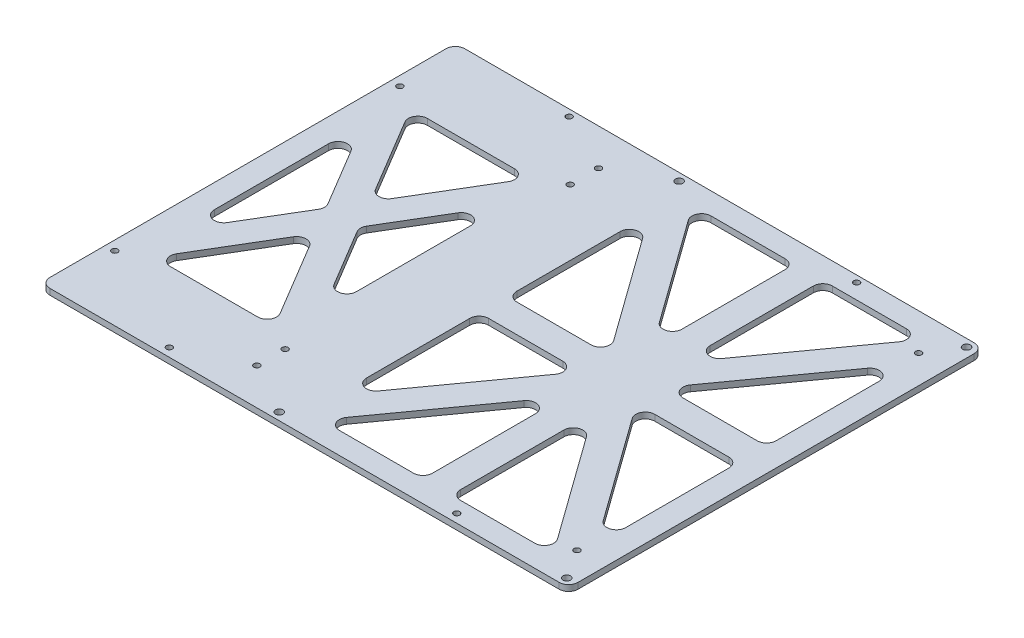
from build123d import *

# Parameters (mm, degrees)
SKETCH1_R                  = 3.175
BODY_DEPTH                 = 6.35
ELECTRONICS_BOX_REACH      = 358.146
SKETCH3_R                  = 4
BATTERY_CHARGER_REACH      = 358.146
SKETCH5_R                  = 3.175
FILLETS_REACH              = 358.146
PLANT_MOUNTING_HOLES_REACH = 358.146
SKETCH7_R                  = 3.175


with BuildPart() as part:
    # Sketch1 → Body (new body)
    with BuildSketch(Plane(origin=(0, 0, 0), x_dir=(1, 0, 0), z_dir=(0, 1, 0))):
        with BuildLine():
            Line((-280, -210), (-280, 210))
            ThreePointArc((-280, 210), (-277.071067812, 217.071067812), (-270, 220))
            Line((-270, 220), (270, 220))
            ThreePointArc((270, 220), (277.071067812, 217.071067812), (280, 210))
            Line((280, 210), (280, -210))
            ThreePointArc((280, -210), (277.071067812, -217.071067812), (270, -220))
            Line((270, -220), (-270, -220))
            ThreePointArc((-270, -220), (-277.071067812, -217.071067812), (-280, -210))
        make_face()
        with Locations((-152.4, -210.96)):
            Circle(SKETCH1_R, mode=Mode.SUBTRACT)
        with Locations((152.4, -210.96)):
            Circle(SKETCH1_R, mode=Mode.SUBTRACT)
        with Locations((152.4, 213)):
            Circle(SKETCH1_R, mode=Mode.SUBTRACT)
        with Locations((-152.4, 213)):
            Circle(SKETCH1_R, mode=Mode.SUBTRACT)
    extrude(amount=BODY_DEPTH)

    # Sketch3 → Electronics Box (cut, up to next)
    with BuildSketch(Plane(origin=(0, 6.35, 0), x_dir=(1, 0, 0), z_dir=(0, 1, 0)), mode=Mode.PRIVATE) as electronics_box_sk1:
        with Locations((-34.8, -211.98)):
            Circle(SKETCH3_R)
    electronics_box_tool1 = extrude(electronics_box_sk1.sketch, amount=-ELECTRONICS_BOX_REACH, mode=Mode.PRIVATE) & part.part
    # Sketch3 → Electronics Box (cut, up to next)
    with BuildSketch(Plane(origin=(0, 6.35, 0), x_dir=(1, 0, 0), z_dir=(0, 1, 0)), mode=Mode.PRIVATE) as electronics_box_sk2:
        with Locations((270, -211.98)):
            Circle(SKETCH3_R)
    electronics_box_tool2 = extrude(electronics_box_sk2.sketch, amount=-ELECTRONICS_BOX_REACH, mode=Mode.PRIVATE) & part.part
    # Sketch3 → Electronics Box (cut, up to next)
    with BuildSketch(Plane(origin=(0, 6.35, 0), x_dir=(1, 0, 0), z_dir=(0, 1, 0)), mode=Mode.PRIVATE) as electronics_box_sk3:
        with Locations((270, 211.98)):
            Circle(SKETCH3_R)
    electronics_box_tool3 = extrude(electronics_box_sk3.sketch, amount=-ELECTRONICS_BOX_REACH, mode=Mode.PRIVATE) & part.part
    # Sketch3 → Electronics Box (cut, up to next)
    with BuildSketch(Plane(origin=(0, 6.35, 0), x_dir=(1, 0, 0), z_dir=(0, 1, 0)), mode=Mode.PRIVATE) as electronics_box_sk4:
        with Locations((-34.8, 211.98)):
            Circle(SKETCH3_R)
    electronics_box_tool4 = extrude(electronics_box_sk4.sketch, amount=-ELECTRONICS_BOX_REACH, mode=Mode.PRIVATE) & part.part
    add(electronics_box_tool1.solids().sort_by_distance((-34.8, 6.35, 211.98))[0], mode=Mode.SUBTRACT)
    add(electronics_box_tool2.solids().sort_by_distance((270, 6.35, 211.98))[0], mode=Mode.SUBTRACT)
    add(electronics_box_tool3.solids().sort_by_distance((270, 6.35, -211.98))[0], mode=Mode.SUBTRACT)
    add(electronics_box_tool4.solids().sort_by_distance((-34.8, 6.35, -211.98))[0], mode=Mode.SUBTRACT)

    # Sketch5 → Battery Charger (cut, up to next)
    with BuildSketch(Plane(origin=(0, 6.35, 0), x_dir=(1, 0, 0), z_dir=(0, 1, 0)), mode=Mode.PRIVATE) as battery_charger_sk1:
        with Locations((-270, -151.13)):
            Circle(SKETCH5_R)
    battery_charger_tool1 = extrude(battery_charger_sk1.sketch, amount=-BATTERY_CHARGER_REACH, mode=Mode.PRIVATE) & part.part
    # Sketch5 → Battery Charger (cut, up to next)
    with BuildSketch(Plane(origin=(0, 6.35, 0), x_dir=(1, 0, 0), z_dir=(0, 1, 0)), mode=Mode.PRIVATE) as battery_charger_sk2:
        with Locations((-270, 151.13)):
            Circle(SKETCH5_R)
    battery_charger_tool2 = extrude(battery_charger_sk2.sketch, amount=-BATTERY_CHARGER_REACH, mode=Mode.PRIVATE) & part.part
    # Sketch5 → Battery Charger (cut, up to next)
    with BuildSketch(Plane(origin=(0, 6.35, 0), x_dir=(1, 0, 0), z_dir=(0, 1, 0)), mode=Mode.PRIVATE) as battery_charger_sk3:
        with Locations((-89.43, -151.13)):
            Circle(SKETCH5_R)
    battery_charger_tool3 = extrude(battery_charger_sk3.sketch, amount=-BATTERY_CHARGER_REACH, mode=Mode.PRIVATE) & part.part
    # Sketch5 → Battery Charger (cut, up to next)
    with BuildSketch(Plane(origin=(0, 6.35, 0), x_dir=(1, 0, 0), z_dir=(0, 1, 0)), mode=Mode.PRIVATE) as battery_charger_sk4:
        with Locations((-89.43, 151.13)):
            Circle(SKETCH5_R)
    battery_charger_tool4 = extrude(battery_charger_sk4.sketch, amount=-BATTERY_CHARGER_REACH, mode=Mode.PRIVATE) & part.part
    add(battery_charger_tool1.solids().sort_by_distance((-270, 6.35, 151.13))[0], mode=Mode.SUBTRACT)
    add(battery_charger_tool2.solids().sort_by_distance((-270, 6.35, -151.13))[0], mode=Mode.SUBTRACT)
    add(battery_charger_tool3.solids().sort_by_distance((-89.43, 6.35, 151.13))[0], mode=Mode.SUBTRACT)
    add(battery_charger_tool4.solids().sort_by_distance((-89.43, 6.35, -151.13))[0], mode=Mode.SUBTRACT)

    # Sketch6 → Fillets (cut, up to next)
    with BuildSketch(Plane(origin=(0, 6.35, 0), x_dir=(1, 0, 0), z_dir=(0, 1, 0)), mode=Mode.PRIVATE) as fillets_sk1:
        with BuildLine():
            Line((-255, 60.535084541), (-255, -60.535084541))
            ThreePointArc((-255, -60.535084541), (-247.660110592, -70.17478431), (-236.415237673, -65.663618033))
            Line((-236.415237673, -65.663618033), (-200.251603002, -5.128533492))
            ThreePointArc((-200.251603002, -5.128533492), (-198.836365329, 0), (-200.251603002, 5.128533492))
            Line((-200.251603002, 5.128533492), (-236.415237673, 65.663618033))
            ThreePointArc((-236.415237673, 65.663618033), (-247.660110592, 70.17478431), (-255, 60.535084541))
        make_face()
    fillets_tool1 = extrude(fillets_sk1.sketch, amount=-FILLETS_REACH, mode=Mode.PRIVATE) & part.part
    # Sketch6 → Fillets (cut, up to next)
    with BuildSketch(Plane(origin=(0, 6.35, 0), x_dir=(1, 0, 0), z_dir=(0, 1, 0)), mode=Mode.PRIVATE) as fillets_sk2:
        with BuildLine():
            Line((-159.178396998, 5.128533492), (-123.014762327, 65.663618033))
            ThreePointArc((-123.014762327, 65.663618033), (-111.769889408, 70.17478431), (-104.43, 60.535084541))
            Line((-104.43, 60.535084541), (-104.43, -60.535084541))
            ThreePointArc((-104.43, -60.535084541), (-111.769889408, -70.17478431), (-123.014762327, -65.663618033))
            Line((-123.014762327, -65.663618033), (-159.178396998, -5.128533492))
            ThreePointArc((-159.178396998, -5.128533492), (-160.593634671, 0), (-159.178396998, 5.128533492))
        make_face()
    fillets_tool2 = extrude(fillets_sk2.sketch, amount=-FILLETS_REACH, mode=Mode.PRIVATE) & part.part
    # Sketch6 → Fillets (cut, up to next)
    with BuildSketch(Plane(origin=(0, 6.35, 0), x_dir=(1, 0, 0), z_dir=(0, 1, 0)), mode=Mode.PRIVATE) as fillets_sk3:
        with BuildLine():
            Line((-234.528407254, -121.001466508), (-188.299762327, -43.618345194))
            ThreePointArc((-188.299762327, -43.618345194), (-179.715, -38.746878687), (-171.130237673, -43.618345194))
            Line((-171.130237673, -43.618345194), (-124.901592746, -121.001466508))
            ThreePointArc((-124.901592746, -121.001466508), (-124.78907576, -131.065314837), (-133.486355073, -136.13))
            Line((-133.486355073, -136.13), (-225.943644927, -136.13))
            ThreePointArc((-225.943644927, -136.13), (-234.64092424, -131.065314837), (-234.528407254, -121.001466508))
        make_face()
    fillets_tool3 = extrude(fillets_sk3.sketch, amount=-FILLETS_REACH, mode=Mode.PRIVATE) & part.part
    # Sketch6 → Fillets (cut, up to next)
    with BuildSketch(Plane(origin=(0, 6.35, 0), x_dir=(1, 0, 0), z_dir=(0, 1, 0)), mode=Mode.PRIVATE) as fillets_sk4:
        with BuildLine():
            Line((-171.130237673, 43.618345194), (-124.901592746, 121.001466508))
            ThreePointArc((-124.901592746, 121.001466508), (-124.78907576, 131.065314837), (-133.486355073, 136.13))
            Line((-133.486355073, 136.13), (-225.943644927, 136.13))
            ThreePointArc((-225.943644927, 136.13), (-234.64092424, 131.065314837), (-234.528407254, 121.001466508))
            Line((-234.528407254, 121.001466508), (-188.299762327, 43.618345194))
            ThreePointArc((-188.299762327, 43.618345194), (-179.715, 38.746878687), (-171.130237673, 43.618345194))
        make_face()
    fillets_tool4 = extrude(fillets_sk4.sketch, amount=-FILLETS_REACH, mode=Mode.PRIVATE) & part.part
    # Sketch6 → Fillets (cut, up to next)
    with BuildSketch(Plane(origin=(0, 6.35, 0), x_dir=(1, 0, 0), z_dir=(0, 1, 0)), mode=Mode.PRIVATE) as fillets_sk5:
        with BuildLine():
            Line((-1.680561104, 140.21611569), (76.955740185, 30.837354881))
            ThreePointArc((76.955740185, 30.837354881), (77.734996384, 20.437848578), (68.836301289, 15))
            Line((68.836301289, 15), (-9.8, 15))
            ThreePointArc((-9.8, 15), (-16.871067812, 17.928932188), (-19.8, 25))
            Line((-19.8, 25), (-19.8, 134.378760808))
            ThreePointArc((-19.8, 134.378760808), (-12.866399439, 143.897016661), (-1.680561104, 140.21611569))
        make_face()
    fillets_tool5 = extrude(fillets_sk5.sketch, amount=-FILLETS_REACH, mode=Mode.PRIVATE) & part.part
    # Sketch6 → Fillets (cut, up to next)
    with BuildSketch(Plane(origin=(0, 6.35, 0), x_dir=(1, 0, 0), z_dir=(0, 1, 0)), mode=Mode.PRIVATE) as fillets_sk6:
        with BuildLine():
            Line((255, 25), (255, 134.378760808))
            ThreePointArc((255, 134.378760808), (248.066399439, 143.897016661), (236.880561104, 140.21611569))
            Line((236.880561104, 140.21611569), (158.244259815, 30.837354881))
            ThreePointArc((158.244259815, 30.837354881), (157.465003616, 20.437848578), (166.363698711, 15))
            Line((166.363698711, 15), (245, 15))
            ThreePointArc((245, 15), (252.071067812, 17.928932188), (255, 25))
        make_face()
    fillets_tool6 = extrude(fillets_sk6.sketch, amount=-FILLETS_REACH, mode=Mode.PRIVATE) & part.part
    # Sketch6 → Fillets (cut, up to next)
    with BuildSketch(Plane(origin=(0, 6.35, 0), x_dir=(1, 0, 0), z_dir=(0, 1, 0)), mode=Mode.PRIVATE) as fillets_sk7:
        with BuildLine():
            Line((84.480561104, 71.76388431), (5.844259815, 181.142645119))
            ThreePointArc((5.844259815, 181.142645119), (5.065003616, 191.542151422), (13.963698711, 196.98))
            Line((13.963698711, 196.98), (92.6, 196.98))
            ThreePointArc((92.6, 196.98), (99.671067812, 194.051067812), (102.6, 186.98))
            Line((102.6, 186.98), (102.6, 77.601239192))
            ThreePointArc((102.6, 77.601239192), (95.666399439, 68.082983339), (84.480561104, 71.76388431))
        make_face()
    fillets_tool7 = extrude(fillets_sk7.sketch, amount=-FILLETS_REACH, mode=Mode.PRIVATE) & part.part
    # Sketch6 → Fillets (cut, up to next)
    with BuildSketch(Plane(origin=(0, 6.35, 0), x_dir=(1, 0, 0), z_dir=(0, 1, 0)), mode=Mode.PRIVATE) as fillets_sk8:
        with BuildLine():
            Line((221.236301289, 196.98), (142.6, 196.98))
            ThreePointArc((142.6, 196.98), (135.528932188, 194.051067812), (132.6, 186.98))
            Line((132.6, 186.98), (132.6, 77.601239192))
            ThreePointArc((132.6, 77.601239192), (139.533600561, 68.082983339), (150.719438896, 71.76388431))
            Line((150.719438896, 71.76388431), (229.355740185, 181.142645119))
            ThreePointArc((229.355740185, 181.142645119), (230.134996384, 191.542151422), (221.236301289, 196.98))
        make_face()
    fillets_tool8 = extrude(fillets_sk8.sketch, amount=-FILLETS_REACH, mode=Mode.PRIVATE) & part.part
    # Sketch6 → Fillets (cut, up to next)
    with BuildSketch(Plane(origin=(0, 6.35, 0), x_dir=(1, 0, 0), z_dir=(0, 1, 0)), mode=Mode.PRIVATE) as fillets_sk9:
        with BuildLine():
            Line((102.6, -77.601239192), (102.6, -186.98))
            ThreePointArc((102.6, -186.98), (99.671067812, -194.051067812), (92.6, -196.98))
            Line((92.6, -196.98), (13.963698711, -196.98))
            ThreePointArc((13.963698711, -196.98), (5.065003616, -191.542151422), (5.844259815, -181.142645119))
            Line((5.844259815, -181.142645119), (84.480561104, -71.76388431))
            ThreePointArc((84.480561104, -71.76388431), (95.666399439, -68.082983339), (102.6, -77.601239192))
        make_face()
    fillets_tool9 = extrude(fillets_sk9.sketch, amount=-FILLETS_REACH, mode=Mode.PRIVATE) & part.part
    # Sketch6 → Fillets (cut, up to next)
    with BuildSketch(Plane(origin=(0, 6.35, 0), x_dir=(1, 0, 0), z_dir=(0, 1, 0)), mode=Mode.PRIVATE) as fillets_sk10:
        with BuildLine():
            Line((150.719438896, -71.76388431), (229.355740185, -181.142645119))
            ThreePointArc((229.355740185, -181.142645119), (230.134996384, -191.542151422), (221.236301289, -196.98))
            Line((221.236301289, -196.98), (142.6, -196.98))
            ThreePointArc((142.6, -196.98), (135.528932188, -194.051067812), (132.6, -186.98))
            Line((132.6, -186.98), (132.6, -77.601239192))
            ThreePointArc((132.6, -77.601239192), (139.533600561, -68.082983339), (150.719438896, -71.76388431))
        make_face()
    fillets_tool10 = extrude(fillets_sk10.sketch, amount=-FILLETS_REACH, mode=Mode.PRIVATE) & part.part
    # Sketch6 → Fillets (cut, up to next)
    with BuildSketch(Plane(origin=(0, 6.35, 0), x_dir=(1, 0, 0), z_dir=(0, 1, 0)), mode=Mode.PRIVATE) as fillets_sk11:
        with BuildLine():
            Line((236.880561104, -140.21611569), (158.244259815, -30.837354881))
            ThreePointArc((158.244259815, -30.837354881), (157.465003616, -20.437848578), (166.363698711, -15))
            Line((166.363698711, -15), (245, -15))
            ThreePointArc((245, -15), (252.071067812, -17.928932188), (255, -25))
            Line((255, -25), (255, -134.378760808))
            ThreePointArc((255, -134.378760808), (248.066399439, -143.897016661), (236.880561104, -140.21611569))
        make_face()
    fillets_tool11 = extrude(fillets_sk11.sketch, amount=-FILLETS_REACH, mode=Mode.PRIVATE) & part.part
    # Sketch6 → Fillets (cut, up to next)
    with BuildSketch(Plane(origin=(0, 6.35, 0), x_dir=(1, 0, 0), z_dir=(0, 1, 0)), mode=Mode.PRIVATE) as fillets_sk12:
        with BuildLine():
            Line((-19.8, -25), (-19.8, -134.378760808))
            ThreePointArc((-19.8, -134.378760808), (-12.866399439, -143.897016661), (-1.680561104, -140.21611569))
            Line((-1.680561104, -140.21611569), (76.955740185, -30.837354881))
            ThreePointArc((76.955740185, -30.837354881), (77.734996384, -20.437848578), (68.836301289, -15))
            Line((68.836301289, -15), (-9.8, -15))
            ThreePointArc((-9.8, -15), (-16.871067812, -17.928932188), (-19.8, -25))
        make_face()
    fillets_tool12 = extrude(fillets_sk12.sketch, amount=-FILLETS_REACH, mode=Mode.PRIVATE) & part.part
    add(fillets_tool1.solids().sort_by_distance((-234.493731, 6.35, 0))[0], mode=Mode.SUBTRACT)
    add(fillets_tool2.solids().sort_by_distance((-124.936269, 6.35, 0))[0], mode=Mode.SUBTRACT)
    add(fillets_tool3.solids().sort_by_distance((-179.715, 6.35, 100.443358))[0], mode=Mode.SUBTRACT)
    add(fillets_tool4.solids().sort_by_distance((-179.715, 6.35, -100.443358))[0], mode=Mode.SUBTRACT)
    add(fillets_tool5.solids().sort_by_distance((16.371701, 6.35, -63.773404))[0], mode=Mode.SUBTRACT)
    add(fillets_tool6.solids().sort_by_distance((218.828299, 6.35, -63.773404))[0], mode=Mode.SUBTRACT)
    add(fillets_tool7.solids().sort_by_distance((66.428299, 6.35, -148.206596))[0], mode=Mode.SUBTRACT)
    add(fillets_tool8.solids().sort_by_distance((168.771701, 6.35, -148.206596))[0], mode=Mode.SUBTRACT)
    add(fillets_tool9.solids().sort_by_distance((66.428299, 6.35, 148.206596))[0], mode=Mode.SUBTRACT)
    add(fillets_tool10.solids().sort_by_distance((168.771701, 6.35, 148.206596))[0], mode=Mode.SUBTRACT)
    add(fillets_tool11.solids().sort_by_distance((218.828299, 6.35, 63.773404))[0], mode=Mode.SUBTRACT)
    add(fillets_tool12.solids().sort_by_distance((16.371701, 6.35, 63.773404))[0], mode=Mode.SUBTRACT)

    # Sketch7 → Plant Mounting holes (cut, up to next)
    with BuildSketch(Plane(origin=(0, 6.35, 0), x_dir=(1, 0, 0), z_dir=(0, 1, 0)), mode=Mode.PRIVATE) as plant_mounting_holes_sk1:
        with Locations((250, 181.13)):
            Circle(SKETCH7_R)
    plant_mounting_holes_tool1 = extrude(plant_mounting_holes_sk1.sketch, amount=-PLANT_MOUNTING_HOLES_REACH, mode=Mode.PRIVATE) & part.part
    # Sketch7 → Plant Mounting holes (cut, up to next)
    with BuildSketch(Plane(origin=(0, 6.35, 0), x_dir=(1, 0, 0), z_dir=(0, 1, 0)), mode=Mode.PRIVATE) as plant_mounting_holes_sk2:
        with Locations((-89.43, 181.13)):
            Circle(SKETCH7_R)
    plant_mounting_holes_tool2 = extrude(plant_mounting_holes_sk2.sketch, amount=-PLANT_MOUNTING_HOLES_REACH, mode=Mode.PRIVATE) & part.part
    # Sketch7 → Plant Mounting holes (cut, up to next)
    with BuildSketch(Plane(origin=(0, 6.35, 0), x_dir=(1, 0, 0), z_dir=(0, 1, 0)), mode=Mode.PRIVATE) as plant_mounting_holes_sk3:
        with Locations((-89.43, -181.13)):
            Circle(SKETCH7_R)
    plant_mounting_holes_tool3 = extrude(plant_mounting_holes_sk3.sketch, amount=-PLANT_MOUNTING_HOLES_REACH, mode=Mode.PRIVATE) & part.part
    # Sketch7 → Plant Mounting holes (cut, up to next)
    with BuildSketch(Plane(origin=(0, 6.35, 0), x_dir=(1, 0, 0), z_dir=(0, 1, 0)), mode=Mode.PRIVATE) as plant_mounting_holes_sk4:
        with Locations((250, -181.13)):
            Circle(SKETCH7_R)
    plant_mounting_holes_tool4 = extrude(plant_mounting_holes_sk4.sketch, amount=-PLANT_MOUNTING_HOLES_REACH, mode=Mode.PRIVATE) & part.part
    add(plant_mounting_holes_tool1.solids().sort_by_distance((250, 6.35, -181.13))[0], mode=Mode.SUBTRACT)
    add(plant_mounting_holes_tool2.solids().sort_by_distance((-89.43, 6.35, -181.13))[0], mode=Mode.SUBTRACT)
    add(plant_mounting_holes_tool3.solids().sort_by_distance((-89.43, 6.35, 181.13))[0], mode=Mode.SUBTRACT)
    add(plant_mounting_holes_tool4.solids().sort_by_distance((250, 6.35, 181.13))[0], mode=Mode.SUBTRACT)


solid = part.part
